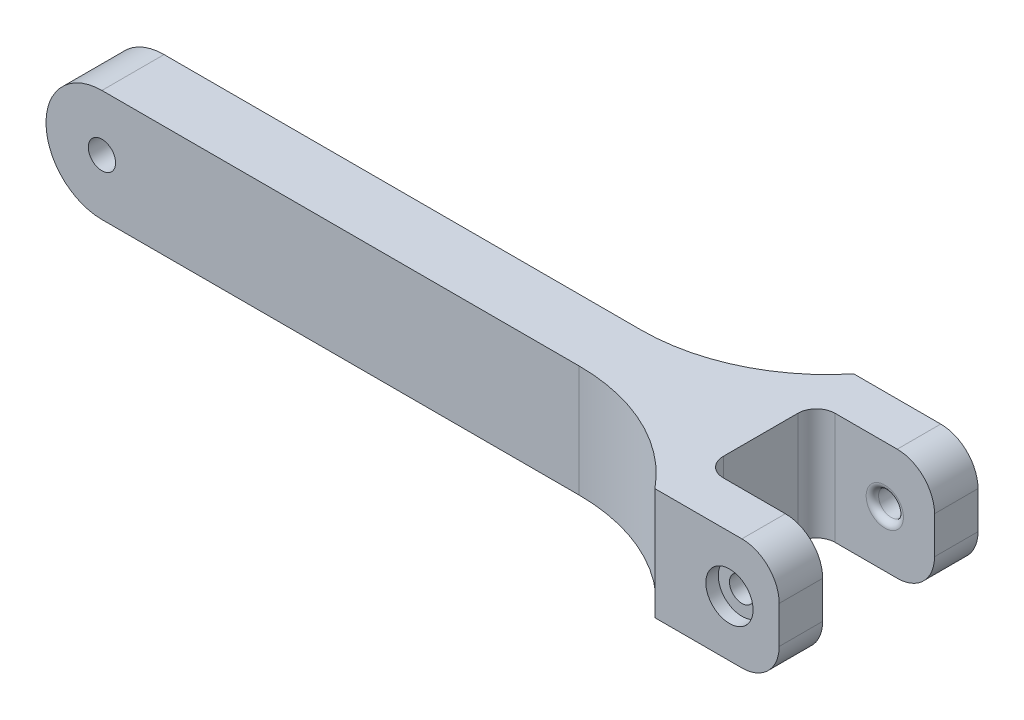
from build123d import *

# Parameters (mm, degrees)
SKETCH1_R           = 1.1
BOSS_EXTRUDE1_DEPTH = 5
BOSS_EXTRUDE2_DEPTH = 9
FILLET1_R           = 15
SKETCH3_R           = 1
CUT_EXTRUDE1_DEPTH  = 16
FILLET2_R           = 3
SKETCH4_R           = 1.9
CUT_EXTRUDE2_DEPTH  = 1
FILLET3_R           = 1.5
FILLET4_R           = 0.5


with BuildPart() as part:
    # Sketch1 → Boss-Extrude1 (new body)
    with BuildSketch(Plane.XY):
        with BuildLine():
            ThreePointArc((0, 4.5), (-4.5, 0), (0, -4.5))
            Line((0, -4.5), (50, -4.5))
            Line((50, -4.5), (50, 4.5))
            Line((50, 4.5), (0, 4.5))
        make_face()
        Circle(SKETCH1_R, mode=Mode.SUBTRACT)
    extrude(amount=BOSS_EXTRUDE1_DEPTH)

    # Sketch2 → Boss-Extrude2 (add)
    with BuildSketch(Plane(origin=(0, 4.5, 0), x_dir=(1, 0, 0), z_dir=(0, 1, 0))):
        Polygon((50.5, 2), (60, 2), (60, 5.5), (50, 5.5), (50, 0), (50, -5), (50, -10.5), (60, -10.5), (60, -7), (50.5, -7), align=None)
    extrude(amount=-BOSS_EXTRUDE2_DEPTH)

    # Fillet1
    # the kernel refuses this fillet: 15 mm, written as the material it adds along each edge
    with BuildSketch(Plane(origin=(50, -4.5, 0), x_dir=(0, 0, -1), z_dir=(0, 1, 0))) as fillet1_piece_1:
        with BuildLine():
            CenterArc((15, 11.608186766), FILLET1_R, 180, 50.703519761)
            Line((0, 11.608186766), (-0.3, 11.608186766))
            Line((-0.3, 11.608186766), (-0.3, 0))
            Line((-0.3, 0), (0, -0.3))
            ThreePointArc((0, -0.3), (2.75, -0.3), (5.31, -0.232163735))
            Line((5.31, -0.232163735), (5.5, 0))
        make_face()
    extrude(amount=9)
    with BuildSketch(Plane(origin=(50, -4.5, 5), x_dir=(0, 0, 1), z_dir=(0, 1, 0))) as fillet1_piece_2:
        with BuildLine():
            CenterArc((15, -11.608186766), FILLET1_R, 129.296480239, 50.703519761)
            Line((0, -11.608186766), (-0.3, -11.608186766))
            Line((-0.3, -11.608186766), (-0.3, 0))
            Line((-0.3, 0), (0, 0.3))
            ThreePointArc((0, 0.3), (2.75, 0.3), (5.31, 0.232163735))
            Line((5.31, 0.232163735), (5.5, 0))
        make_face()
    extrude(amount=9)

    # Sketch3 → Cut-Extrude1 (cut)
    with BuildSketch(Plane.XY.offset(10.5)):
        with Locations((56, 0)):
            Circle(SKETCH3_R)
    extrude(amount=-CUT_EXTRUDE1_DEPTH, mode=Mode.SUBTRACT)

    # Fillet2
    fillet2_edges = [part.edges().sort_by_distance(p)[0] for p in [
        (60, 4.5, 8.75),
        (60, 4.5, -3.75),
        (60, -4.5, 8.75),
        (60, -4.5, -3.75),
    ]]
    fillet(fillet2_edges, radius=FILLET2_R)

    # Sketch4 → Cut-Extrude2 (cut)
    with BuildSketch(Plane.XY.offset(10.5)):
        with Locations((56, 0)):
            Circle(SKETCH4_R)
    extrude(amount=-CUT_EXTRUDE2_DEPTH, mode=Mode.SUBTRACT)

    # Fillet3
    fillet3_edges = [part.edges().sort_by_distance(p)[0] for p in [
        (50.5, 0, 7),
        (50.5, 0, -2),
    ]]
    fillet(fillet3_edges, radius=FILLET3_R)

    # Fillet4
    fillet4_edges = [part.edges().sort_by_distance(p)[0] for p in [
        (55, 0, -2),
    ]]
    fillet(fillet4_edges, radius=FILLET4_R)


solid = part.part
